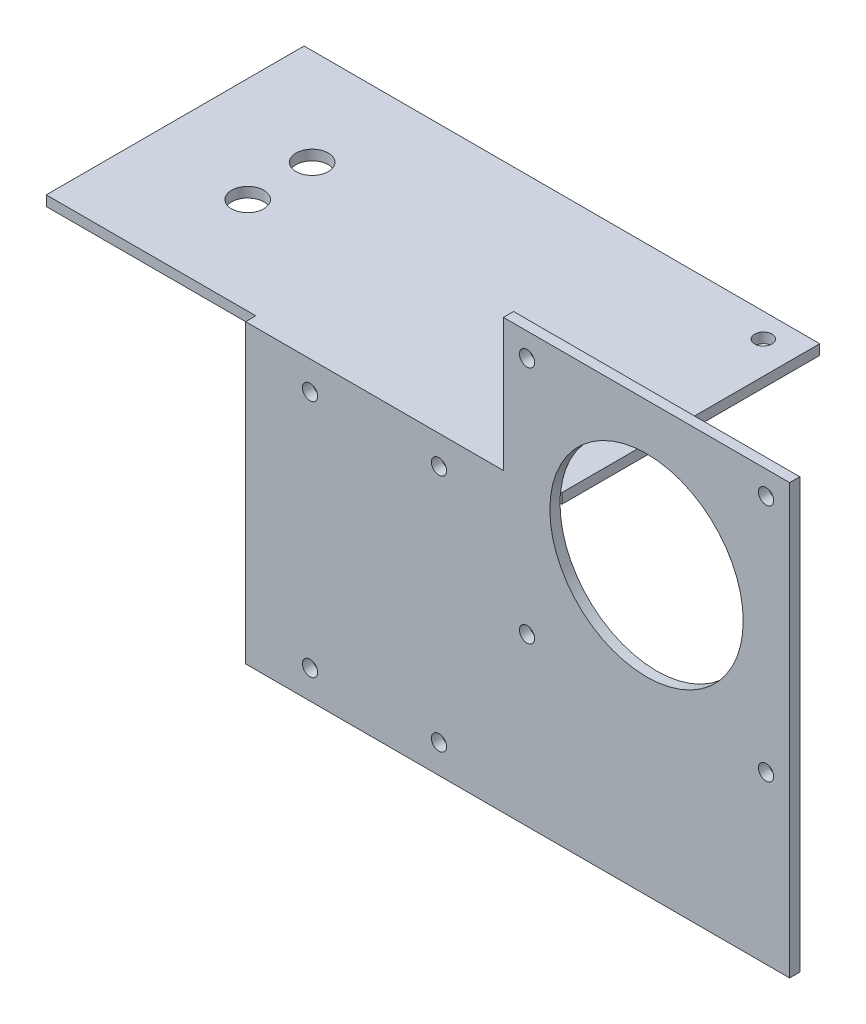
from build123d import *

# Parameters (mm, degrees)
SKETCH1_R           = 1.5
SKETCH1_R_2         = 19.05
BOSS_EXTRUDE1_DEPTH = 2
BOSS_EXTRUDE2_DEPTH = 50.8
SKETCH3_R           = 1.7
SKETCH3_R_2         = 3.175
CUT_EXTRUDE1_DEPTH  = 134.004661572


with BuildPart() as part:
    # Sketch1 → Boss-Extrude1 (new body)
    with BuildSketch(Plane.XY):
        Polygon((0, 58.4), (50.8, 58.4), (50.8, 84.53204182), (107.2, 84.53204182), (107.2, 0), (0, 0), align=None)
        with Locations((102.55, 79.88204182)):
            Circle(SKETCH1_R, mode=Mode.SUBTRACT)
        with Locations((102.55, 32.78204182)):
            Circle(SKETCH1_R, mode=Mode.SUBTRACT)
        with Locations((55.45, 32.78204182)):
            Circle(SKETCH1_R, mode=Mode.SUBTRACT)
        with Locations((55.45, 79.88204182)):
            Circle(SKETCH1_R, mode=Mode.SUBTRACT)
        with Locations((12.7, 52.75)):
            Circle(SKETCH1_R, mode=Mode.SUBTRACT)
        with Locations((38.1, 52.75)):
            Circle(SKETCH1_R, mode=Mode.SUBTRACT)
        with Locations((12.7, 5.65)):
            Circle(SKETCH1_R, mode=Mode.SUBTRACT)
        with Locations((38.1, 5.65)):
            Circle(SKETCH1_R, mode=Mode.SUBTRACT)
        with Locations((79, 56.33204182)):
            Circle(SKETCH1_R_2, mode=Mode.SUBTRACT)
    extrude(amount=-BOSS_EXTRUDE1_DEPTH)

    # Sketch2 → Boss-Extrude2 (add)
    with BuildSketch(Plane(origin=(0, 0, -2), x_dir=(-1, 0, 0), z_dir=(0, 0, -1))):
        Polygon((0, 56.4), (41.275, 56.4), (41.275, 58.4), (0, 58.4), (-60.325, 58.4), (-60.325, 56.4), align=None)
    extrude(amount=BOSS_EXTRUDE2_DEPTH)

    # Sketch3 → Cut-Extrude1 (cut, through all)
    with BuildSketch(Plane(origin=(0, 58.4, 0), x_dir=(1, 0, 0), z_dir=(0, 1, 0))):
        with Locations((53.975, 48.0375)):
            Circle(SKETCH3_R)
        with Locations((53.975, 6.7625)):
            Circle(SKETCH3_R)
        with Locations((-20.6375, 33.75)):
            Circle(SKETCH3_R_2)
        with Locations((-20.6375, 21.05)):
            Circle(SKETCH3_R_2)
    extrude(amount=-CUT_EXTRUDE1_DEPTH, mode=Mode.SUBTRACT)


solid = part.part
